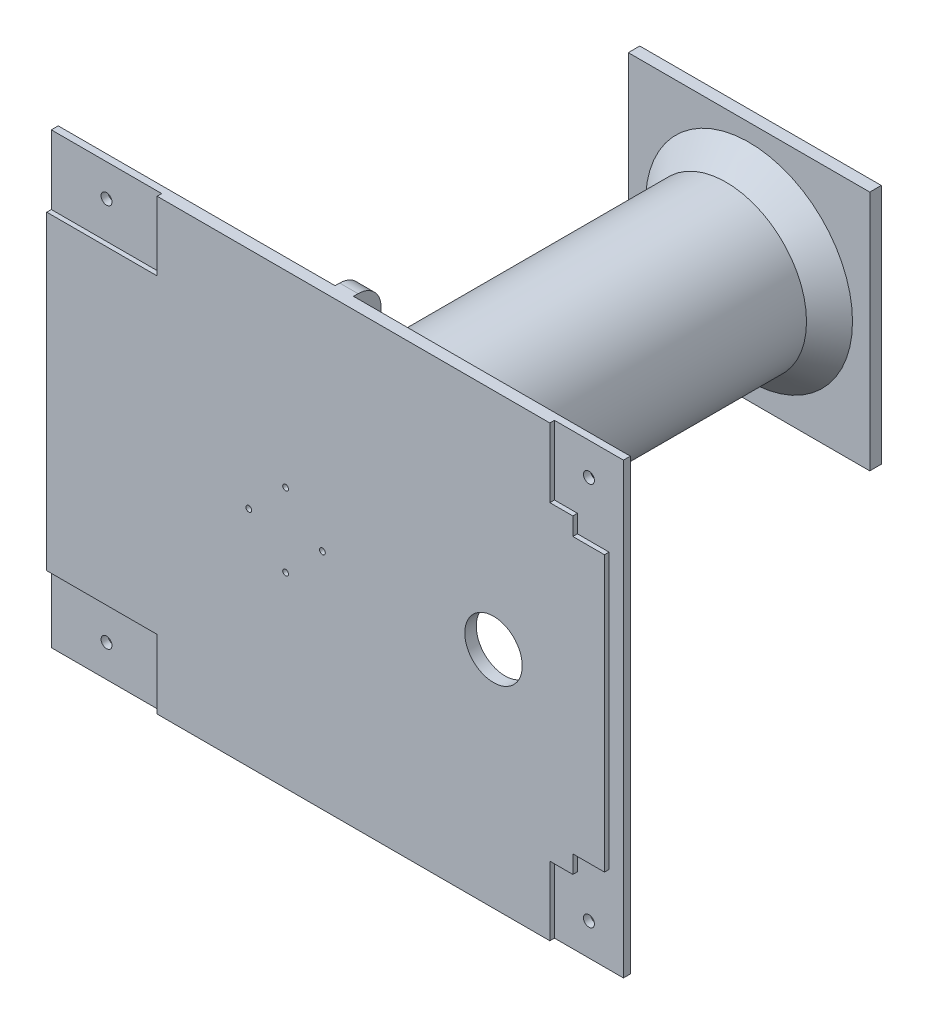
from build123d import *

# Parameters (mm, degrees)
CROQUIS1_W                 = 248.76
CROQUIS1_H                 = 195
SALIENTE_EXTRUIR1_DEPTH    = 5
CROQUIS2_W                 = 48
CROQUIS2_H                 = 30
CROQUIS2_W_2               = 30
CORTAR_EXTRUIR1_DEPTH      = 2
CROQUIS3_R                 = 2.375
CORTAR_EXTRUIR2_DEPTH      = 10
CROQUIS4_R                 = 35
SALIENTE_EXTRUIR2_DEPTH    = 196.5
CROQUIS5_R                 = 12.5
CORTAR_EXTRUIR3_DEPTH      = 10
CROQUIS12_W                = 12
CROQUIS12_H                = 30
SALIENTE_EXTRUIR3_DEPTH    = 4
REDONDEO1_R                = 10
REDONDEO2_R                = 10
REDONDEO3_R                = 10
CORTAR_EXTRUIR5_DEPTH      = 255.266033949
CORTAR_EXTRUIR5_DEPTH_BACK = 255.266033949
CROQUIS13_R                = 1.625
CORTAR_EXTRUIR7_DEPTH      = 2
CROQUIS16_W                = 105
CROQUIS16_H                = 105
SALIENTE_EXTRUIR4_DEPTH    = 5
CHAFL_N1_SIZE              = 10
CROQUIS18_R                = 1.25
CORTAR_EXTRUIR8_DEPTH      = 5


with BuildPart() as part:
    # Croquis1 → Saliente-Extruir1 (new body)
    with BuildSketch(Plane.XY):
        with Locations((7.088293187, 0.26268)):
            Rectangle(CROQUIS1_W, CROQUIS1_H)
    extrude(amount=SALIENTE_EXTRUIR1_DEPTH)

    # Croquis2 → Cortar-Extruir1 (cut)
    with BuildSketch(Plane.XY.offset(5)):
        with Locations((-93.291706813, -82.23732)):
            Rectangle(CROQUIS2_W, CROQUIS2_H)
        with Locations((116.468293187, 82.76268)):
            Rectangle(CROQUIS2_W_2, CROQUIS2_H)
        with Locations((116.468293187, -82.23732)):
            Rectangle(CROQUIS2_W_2, CROQUIS2_H)
        with Locations((-93.291706813, 82.76268)):
            Rectangle(CROQUIS2_W, CROQUIS2_H)
    extrude(amount=-CORTAR_EXTRUIR1_DEPTH, mode=Mode.SUBTRACT)

    # Croquis3 → Cortar-Extruir2 (cut)
    with BuildSketch(Plane.XY.offset(5)):
        with Locations((-93.291706813, 83.76268)):
            Circle(CROQUIS3_R)
        with Locations((-93.291706813, -83.23732)):
            Circle(CROQUIS3_R)
        with Locations((116.468293187, 83.76268)):
            Circle(CROQUIS3_R)
        with Locations((116.468293187, -83.23732)):
            Circle(CROQUIS3_R)
    extrude(amount=-CORTAR_EXTRUIR2_DEPTH, mode=Mode.SUBTRACT)

    # Croquis4 → Saliente-Extruir2 (add)
    with BuildSketch(Plane(origin=(0, 0, 0), x_dir=(-1, 0, 0), z_dir=(0, 0, -1))):
        with Locations((13.431706813, 0.26268)):
            Circle(CROQUIS4_R)
    extrude(amount=SALIENTE_EXTRUIR2_DEPTH)

    # Croquis5 → Cortar-Extruir3 (cut)
    with BuildSketch(Plane(origin=(0, 0, 0), x_dir=(-1, 0, 0), z_dir=(0, 0, -1))):
        with Locations((-76.968293187, 0.26268)):
            Circle(CROQUIS5_R)
    extrude(amount=-CORTAR_EXTRUIR3_DEPTH, mode=Mode.SUBTRACT)

    # Croquis12 → Saliente-Extruir3 (add, symmetric)
    with BuildSketch(Plane(origin=(7.088293187, 0, 0), x_dir=(0, 0, -1), z_dir=(1, 0, 0))):
        with Locations((6, 82.76268)):
            Rectangle(CROQUIS12_W, CROQUIS12_H)
        with Locations((6, -82.23732)):
            Rectangle(CROQUIS12_W, CROQUIS12_H)
    extrude(amount=SALIENTE_EXTRUIR3_DEPTH, both=True)

    # Redondeo1
    redondeo1_edges = [part.edges().sort_by_distance(p)[0] for p in [
        (7.088293187, -67.23732, 0),
        (7.088293187, 67.76268, 0),
    ]]
    fillet(redondeo1_edges, radius=REDONDEO1_R)

    # Redondeo2
    redondeo2_edges = [part.edges().sort_by_distance(p)[0] for p in [
        (7.088293187, 67.76268, -12),
        (7.088293187, -67.23732, -12),
    ]]
    fillet(redondeo2_edges, radius=REDONDEO2_R)

    # Redondeo3
    redondeo3_edges = [part.edges().sort_by_distance(p)[0] for p in [
        (7.088293187, -97.23732, -12),
        (7.088293187, 97.76268, -12),
    ]]
    fillet(redondeo3_edges, radius=REDONDEO3_R)

    # Croquis13 → Cortar-Extruir5 (cut, two sides: drawn at the far end of the back side and taken through both)
    with BuildSketch(Plane(origin=(11.088293187, 0, 0), x_dir=(0, 0, -1), z_dir=(1, 0, 0)).offset(-CORTAR_EXTRUIR5_DEPTH_BACK)):
        with Locations((6, 87.76268)):
            Circle(CROQUIS13_R)
        with Locations((6, 77.76268)):
            Circle(CROQUIS13_R)
        with Locations((6, -77.23732)):
            Circle(CROQUIS13_R)
        with Locations((6, -87.23732)):
            Circle(CROQUIS13_R)
    extrude(amount=CORTAR_EXTRUIR5_DEPTH + CORTAR_EXTRUIR5_DEPTH_BACK, mode=Mode.SUBTRACT)

    # Croquis15 → Cortar-Extruir7 (cut)
    with BuildSketch(Plane.XY.offset(5)):
        Polygon((111.468293187, 67.76268), (131.468293187, 67.76268), (131.468293187, -67.23732), (111.468293187, -67.23732), (111.468293187, -59.48732), (125.218293187, -59.48732), (125.218293187, 60.01268), (111.468293187, 60.01268), align=None)
    extrude(amount=-CORTAR_EXTRUIR7_DEPTH, mode=Mode.SUBTRACT)

    # Croquis16 → Saliente-Extruir4 (add)
    with BuildSketch(Plane(origin=(0, 0, -196.5), x_dir=(-1, 0, 0), z_dir=(0, 0, -1))):
        with Locations((13.431706813, 0.26268)):
            Rectangle(CROQUIS16_W, CROQUIS16_H)
    extrude(amount=SALIENTE_EXTRUIR4_DEPTH)

    # Chaflán1
    chafl_n1_edges = [part.edges().sort_by_distance(p)[0] for p in [
        (21.568293187, 0.26268, -196.5),
    ]]
    chamfer(chafl_n1_edges, length=CHAFL_N1_SIZE)

    # Croquis18 → Cortar-Extruir8 (cut)
    with BuildSketch(Plane.XY.offset(5)):
        with Locations((-13.431706813, 16)):
            Circle(CROQUIS18_R)
        with Locations((2.568293187, 0)):
            Circle(CROQUIS18_R)
        with Locations((-13.431706813, -16)):
            Circle(CROQUIS18_R)
        with Locations((-29.431706813, 0)):
            Circle(CROQUIS18_R)
    extrude(amount=-CORTAR_EXTRUIR8_DEPTH, mode=Mode.SUBTRACT)


solid = part.part
